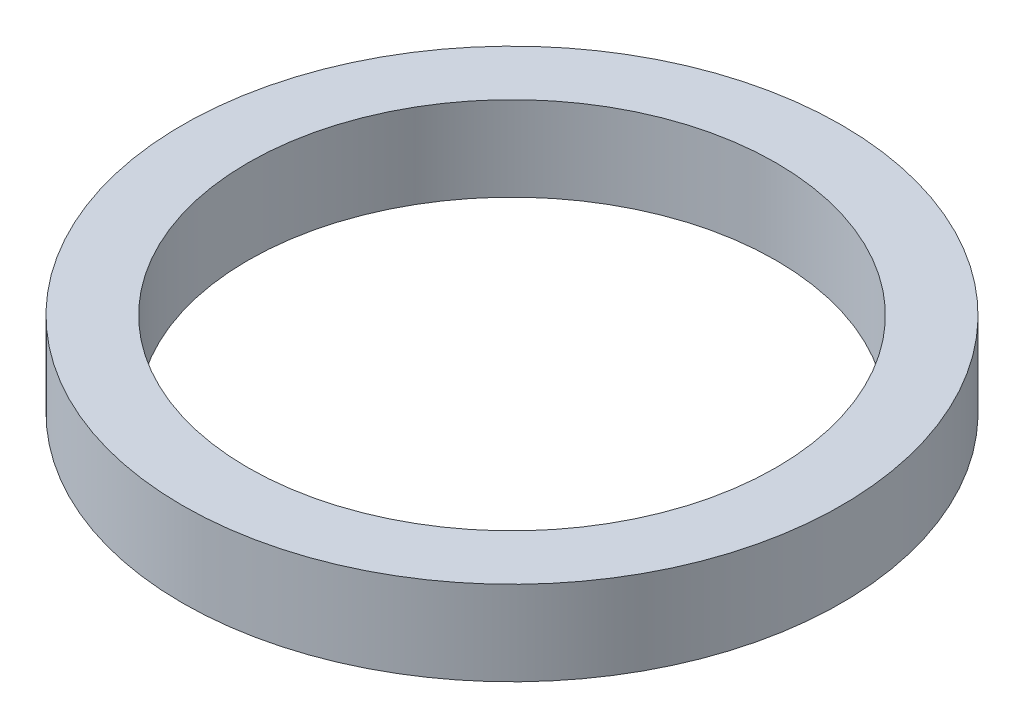
from build123d import *

# Parameters (mm, degrees)
SKETCH2_R           = 49.55
SKETCH2_R_2         = 39.7
BOSS_EXTRUDE1_DEPTH = 12.7


with BuildPart() as part:
    # Sketch2 → Boss-Extrude1 (new body)
    with BuildSketch(Plane(origin=(0, 0, 0), x_dir=(1, 0, 0), z_dir=(0, 1, 0))):
        Circle(SKETCH2_R)
        Circle(SKETCH2_R_2, mode=Mode.SUBTRACT)
    extrude(amount=BOSS_EXTRUDE1_DEPTH)


solid = part.part
